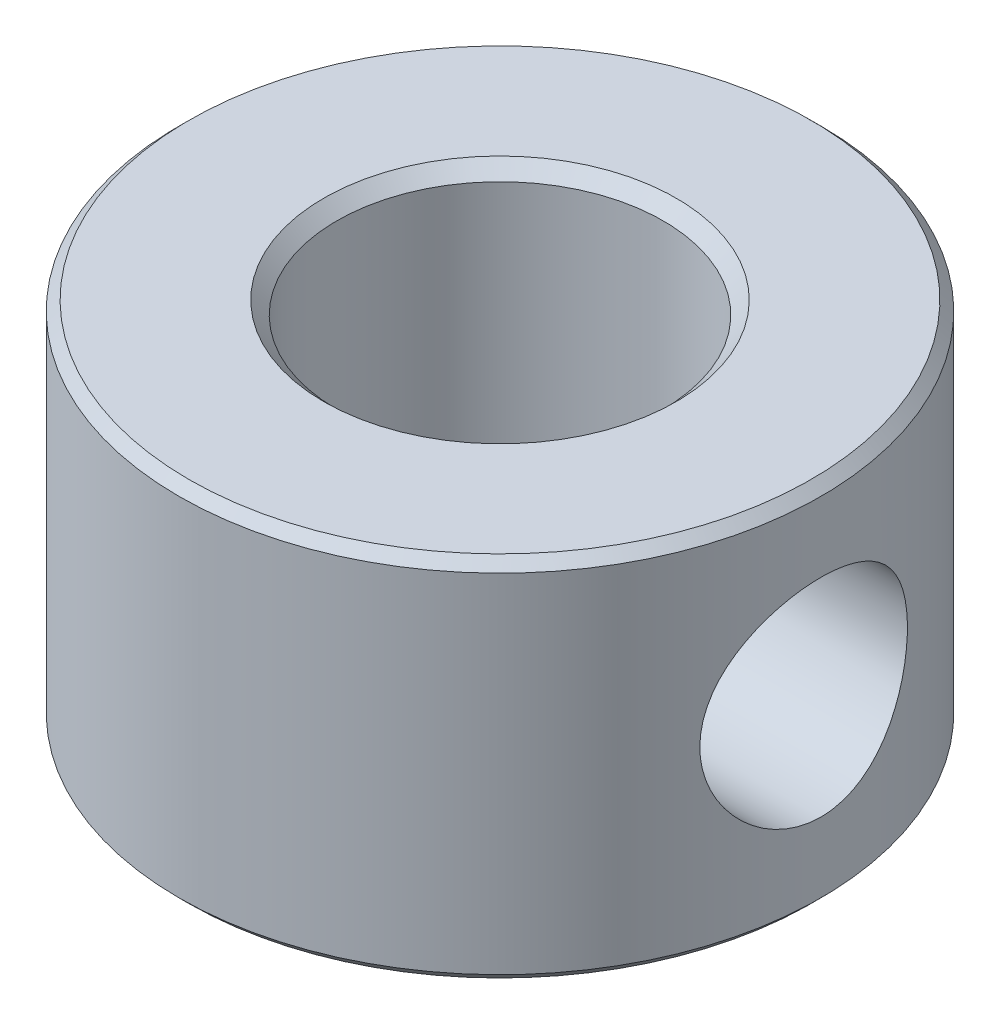
from build123d import *

# Parameters (mm, degrees)
SKETCH1_R           = 6.24205
SKETCH1_R_2         = 3.175
BOSS_EXTRUDE1_DEPTH = 7.14502
CHAMFER1_SIZE       = 0.1905
CHAMFER2_SIZE       = 0.254
SKETCH3_W           = 2.0193
SKETCH3_H           = 6.24205


with BuildPart() as part:
    # Sketch1 → Boss-Extrude1 (new body)
    with BuildSketch(Plane(origin=(0, 0, 0), x_dir=(1, 0, 0), z_dir=(0, 1, 0))):
        Circle(SKETCH1_R)
        Circle(SKETCH1_R_2, mode=Mode.SUBTRACT)
    extrude(amount=BOSS_EXTRUDE1_DEPTH)

    # Chamfer1
    chamfer1_edges = [part.edges().sort_by_distance(p)[0] for p in [
        (-6.24205, 0, 0),
        (-6.24205, 7.14502, 0),
    ]]
    chamfer(chamfer1_edges, length=CHAMFER1_SIZE)

    # Chamfer2
    chamfer2_edges = [part.edges().sort_by_distance(p)[0] for p in [
        (-3.175, 7.14502, 0),
        (-3.175, 0, 0),
    ]]
    chamfer(chamfer2_edges, length=CHAMFER2_SIZE)

    # Sketch3 → #10-32 Tapped Hole1 (revolve, cut)
    with BuildSketch(Plane.ZX.offset(3.57251)):
        with Locations((1.00965, 3.121025)):
            Rectangle(SKETCH3_W, SKETCH3_H)
    revolve(axis=Axis((-6.35, 3.57251, 0), (1, 0, 0)), mode=Mode.SUBTRACT)


solid = part.part
